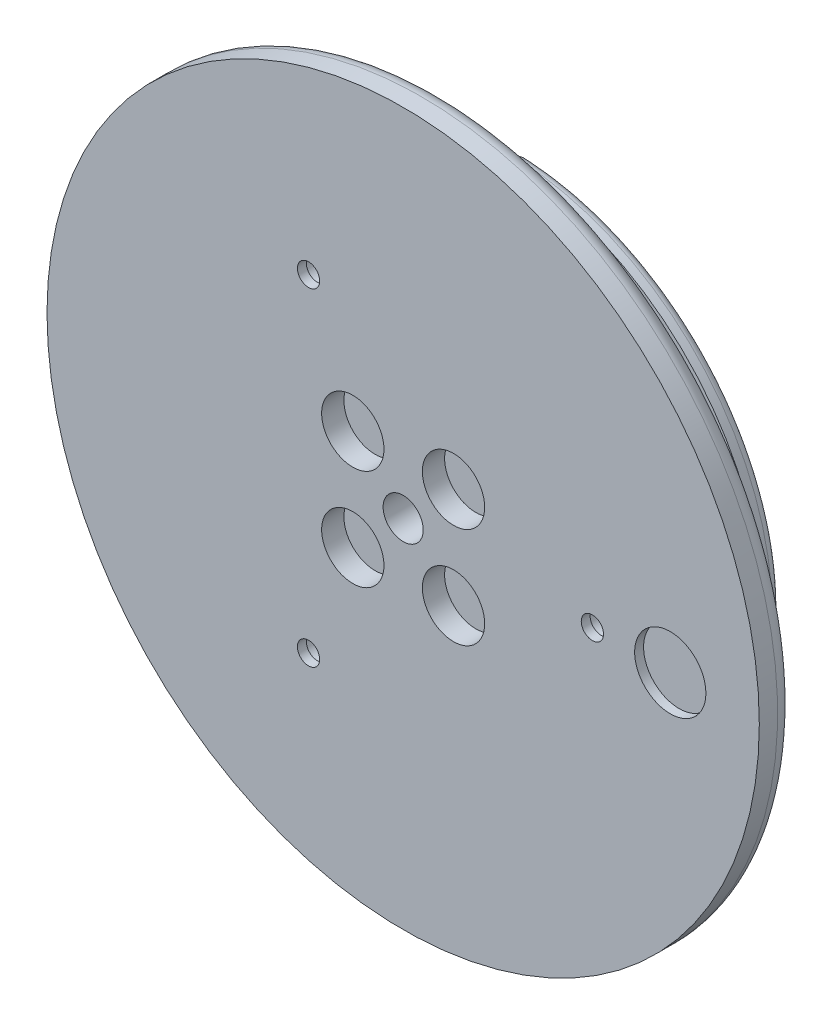
from build123d import *
from build123d.topology import SkipClean

# Parameters (mm, degrees)
SKETCH1_R             = 30
SKETCH1_R_2           = 12.5
BOSS_EXTRUDE1_DEPTH   = 6
SKETCH2_R             = 40
SKETCH2_R_2           = 2.25
SKETCH2_R_3           = 1.5
BOSS_EXTRUDE2_DEPTH   = 4
SKETCH3_R             = 3.5
CUT_EXTRUDE1_DEPTH    = 2.5
SKETCH4_R             = 5.15
CUT_EXTRUDE2_DEPTH    = 3
SKETCH5_R             = 3.5
BOSS_EXTRUDE3_DEPTH   = 0.2
SKETCH6_R             = 1.25
CUT_EXTRUDE3_DEPTH    = 10
SKETCH7_R             = 3.125
CUT_EXTRUDE4_DEPTH    = 9
SKETCH8_R             = 2
CUT_EXTRUDE5_DEPTH    = 8
SKETCH9_R             = 3
BOSS_EXTRUDE4_DEPTH   = 0.5
BOSS_EXTRUDE4_2_DEPTH = 0.5
BOSS_EXTRUDE4_3_DEPTH = 0.5
SKETCH11_R            = 3
SKETCH11_R_2          = 1.5
BOSS_EXTRUDE6_DEPTH   = 3
BOSS_EXTRUDE6_2_DEPTH = 3
BOSS_EXTRUDE6_3_DEPTH = 3
SKETCH10_R            = 30
SKETCH10_R_2          = 2
SKETCH10_R_3          = 12.5
SKETCH10_R_4          = 5.15
BOSS_EXTRUDE7_DEPTH   = 1.2
FILLET1_R             = 10
FILLET2_R             = 2
BOSS_EXTRUDE8_START   = 2
SKETCH12_R            = 12.5
SKETCH12_R_2          = 2.25
SKETCH12_R_3          = 1.5
BOSS_EXTRUDE8_DEPTH   = 2
SKETCH14_R            = 4
CUT_EXTRUDE6_DEPTH    = 1
BOSS_EXTRUDE10_START  = 0.75
SKETCH15_R            = 30
SKETCH15_R_2          = 28
BOSS_EXTRUDE10_DEPTH  = 0.75
FILLET3_R             = 10
FILLET4_R             = 4
FILLET5_R             = 1


with BuildPart() as part:
    # Sketch1 → Boss-Extrude1 (new body)
    with BuildSketch(Plane.XY):
        Circle(SKETCH1_R)
        Circle(SKETCH1_R_2, mode=Mode.SUBTRACT)
    extrude(amount=BOSS_EXTRUDE1_DEPTH)

    # Sketch2 → Boss-Extrude2 (add)
    with BuildSketch(Plane.XY.offset(6)):
        Circle(SKETCH2_R)
        Circle(SKETCH2_R_2, mode=Mode.SUBTRACT)
        with Locations((-5.655999742, 5.657708628)):
            Circle(SKETCH2_R_3, mode=Mode.SUBTRACT)
        with Locations((-5.655999742, -5.657708628)):
            Circle(SKETCH2_R_3, mode=Mode.SUBTRACT)
        with Locations((5.655999742, -5.657708628)):
            Circle(SKETCH2_R_3, mode=Mode.SUBTRACT)
        with Locations((5.655999742, 5.657708628)):
            Circle(SKETCH2_R_3, mode=Mode.SUBTRACT)
    extrude(amount=BOSS_EXTRUDE2_DEPTH)

    # Sketch3 → Cut-Extrude1 (cut)
    with BuildSketch(Plane.XY.offset(10)):
        with Locations((-5.655999742, 5.657708628)):
            Circle(SKETCH3_R)
        with Locations((5.655999742, 5.657708628)):
            Circle(SKETCH3_R)
        with Locations((5.655999742, -5.657708628)):
            Circle(SKETCH3_R)
        with Locations((-5.655999742, -5.657708628)):
            Circle(SKETCH3_R)
    extrude(amount=-CUT_EXTRUDE1_DEPTH, mode=Mode.SUBTRACT)

    # Sketch4 → Cut-Extrude2 (cut)
    with BuildSketch(Plane(origin=(0, 0, 0), x_dir=(-1, 0, 0), z_dir=(0, 0, -1))):
        with Locations((20, 0)):
            Circle(SKETCH4_R)
    extrude(amount=-CUT_EXTRUDE2_DEPTH, mode=Mode.SUBTRACT)

    # Sketch5 → Boss-Extrude3 (add)
    with BuildSketch(Plane.XY.offset(7.5)):
        with Locations((-5.655999742, 5.657708628)):
            Circle(SKETCH5_R)
        with Locations((5.655999742, 5.657708628)):
            Circle(SKETCH5_R)
        with Locations((-5.655999742, -5.657708628)):
            Circle(SKETCH5_R)
        with Locations((5.655999742, -5.657708628)):
            Circle(SKETCH5_R)
    extrude(amount=-BOSS_EXTRUDE3_DEPTH)

    # Sketch6 → Cut-Extrude3 (cut)
    with BuildSketch(Plane(origin=(0, 0, 0), x_dir=(-1, 0, 0), z_dir=(0, 0, -1))):
        with Locations((-21.25, 0)):
            Circle(SKETCH6_R)
        with Locations((10.625, 18.40303983)):
            Circle(SKETCH6_R)
        with Locations((10.625, -18.40303983)):
            Circle(SKETCH6_R)
    extrude(amount=-CUT_EXTRUDE3_DEPTH, mode=Mode.SUBTRACT)

    # Sketch7 → Cut-Extrude4 (cut)
    with BuildSketch(Plane(origin=(0, 0, 0), x_dir=(-1, 0, 0), z_dir=(0, 0, -1))):
        with Locations((-21.25, 0)):
            Circle(SKETCH7_R)
        with Locations((10.625, 18.40303983)):
            Circle(SKETCH7_R)
        with Locations((10.625, -18.40303983)):
            Circle(SKETCH7_R)
    extrude(amount=-CUT_EXTRUDE4_DEPTH, mode=Mode.SUBTRACT)

    # Sketch8 → Cut-Extrude5 (cut)
    with BuildSketch(Plane(origin=(0, 0, 0), x_dir=(-1, 0, 0), z_dir=(0, 0, -1))):
        with Locations((-10, -17.320508076)):
            Circle(SKETCH8_R)
        with Locations((-10, 17.320508076)):
            Circle(SKETCH8_R)
        with Locations((17.320508076, -10)):
            Circle(SKETCH8_R)
        with Locations((0, -20)):
            Circle(SKETCH8_R)
        with Locations((-17.320508076, -10)):
            Circle(SKETCH8_R)
        with Locations((-17.320508076, 10)):
            Circle(SKETCH8_R)
        with Locations((0, 20)):
            Circle(SKETCH8_R)
        with Locations((17.320508076, 10)):
            Circle(SKETCH8_R)
    extrude(amount=-CUT_EXTRUDE5_DEPTH, mode=Mode.SUBTRACT)

    # Fillet1
    # the kernel refuses this fillet: 10 mm, written as the material it adds along each edge
    with BuildSketch(Plane(origin=(0, 0, 6), x_dir=(1, 0, 0), z_dir=(0, -1, 0))) as fillet1_piece_1:
        with BuildLine():
            CenterArc((39.16515139, -10), FILLET1_R, 90, 66.421821522)
            Line((30, -6), (29.816696972, -5.92))
            ThreePointArc((29.816696972, -5.92), (29.8, -3), (29.8, 0))
            Line((29.8, 0), (30, 0.2))
            Line((30, 0.2), (39.16515139, 0.2))
            Line((39.16515139, 0.2), (39.16515139, 0))
        make_face()
    revolve(axis=Axis((0, 0, 6), (0, 0, 1)))

    # Fillet2
    fillet2_edges = [part.edges().sort_by_distance(p)[0] for p in [
        (-40, 0, 6),
    ]]
    fillet(fillet2_edges, radius=FILLET2_R)

    # Sketch12 → Boss-Extrude8 (add)
    with BuildSketch(Plane(origin=(0, 0, 6), x_dir=(-1, 0, 0), z_dir=(0, 0, -1)).offset(BOSS_EXTRUDE8_START)):
        Circle(SKETCH12_R)
        Circle(SKETCH12_R_2, mode=Mode.SUBTRACT)
        with Locations((-5.655999742, 5.657708628)):
            Circle(SKETCH12_R_3, mode=Mode.SUBTRACT)
        with Locations((5.655999742, 5.657708628)):
            Circle(SKETCH12_R_3, mode=Mode.SUBTRACT)
        with Locations((5.655999742, -5.657708628)):
            Circle(SKETCH12_R_3, mode=Mode.SUBTRACT)
        with Locations((-5.655999742, -5.657708628)):
            Circle(SKETCH12_R_3, mode=Mode.SUBTRACT)
    extrude(amount=-BOSS_EXTRUDE8_DEPTH)

    # Sketch14 → Cut-Extrude6 (cut)
    with BuildSketch(Plane.XY.offset(10)):
        with Locations((30, 0)):
            Circle(SKETCH14_R)
    extrude(amount=-CUT_EXTRUDE6_DEPTH, mode=Mode.SUBTRACT)


with BuildPart() as body_2:
    # Sketch9 → Boss-Extrude4 (new body)
    with BuildSketch(Plane(origin=(0, 0, 0), x_dir=(-1, 0, 0), z_dir=(0, 0, -1))):
        with Locations((-21.25, 0)):
            Circle(SKETCH9_R)
    extrude(amount=BOSS_EXTRUDE4_DEPTH)


with BuildPart() as body_3:
    # Sketch9 → Boss-Extrude4 2 (new body)
    with BuildSketch(Plane(origin=(0, 0, 0), x_dir=(-1, 0, 0), z_dir=(0, 0, -1))):
        with Locations((10.625, 18.40303983)):
            Circle(SKETCH9_R)
    extrude(amount=BOSS_EXTRUDE4_2_DEPTH)


with BuildPart() as body_4:
    # Sketch9 → Boss-Extrude4 3 (new body)
    with BuildSketch(Plane(origin=(0, 0, 0), x_dir=(-1, 0, 0), z_dir=(0, 0, -1))):
        with Locations((10.625, -18.40303983)):
            Circle(SKETCH9_R)
    extrude(amount=BOSS_EXTRUDE4_3_DEPTH)


with BuildPart() as body_5:
    # Sketch11 → Boss-Extrude6 (new body)
    with BuildSketch(Plane(origin=(0, 0, 9), x_dir=(-1, 0, 0), z_dir=(0, 0, -1))):
        with Locations((-21.25, 0)):
            Circle(SKETCH11_R)
        with Locations((-21.25, 0)):
            Circle(SKETCH11_R_2, mode=Mode.SUBTRACT)
    extrude(amount=BOSS_EXTRUDE6_DEPTH)


with BuildPart() as body_6:
    # Sketch11 → Boss-Extrude6 2 (new body)
    with BuildSketch(Plane(origin=(0, 0, 9), x_dir=(-1, 0, 0), z_dir=(0, 0, -1))):
        with Locations((10.625, 18.40303983)):
            Circle(SKETCH11_R)
        with Locations((10.625, 18.40303983)):
            Circle(SKETCH11_R_2, mode=Mode.SUBTRACT)
    extrude(amount=BOSS_EXTRUDE6_2_DEPTH)


with BuildPart() as body_7:
    # Sketch11 → Boss-Extrude6 3 (new body)
    with BuildSketch(Plane(origin=(0, 0, 9), x_dir=(-1, 0, 0), z_dir=(0, 0, -1))):
        with Locations((10.625, -18.40303983)):
            Circle(SKETCH11_R)
        with Locations((10.625, -18.40303983)):
            Circle(SKETCH11_R_2, mode=Mode.SUBTRACT)
    extrude(amount=BOSS_EXTRUDE6_3_DEPTH)


with BuildPart() as body_8:
    # Sketch10 → Boss-Extrude7 (new body)
    with BuildSketch(Plane(origin=(0, 0, -0.5), x_dir=(-1, 0, 0), z_dir=(0, 0, -1))):
        Circle(SKETCH10_R)
        with Locations((-10, 17.320508076)):
            Circle(SKETCH10_R_2, mode=Mode.SUBTRACT)
        with Locations((-10, -17.320508076)):
            Circle(SKETCH10_R_2, mode=Mode.SUBTRACT)
        with Locations((-17.320508076, 10)):
            Circle(SKETCH10_R_2, mode=Mode.SUBTRACT)
        with Locations((0, 20)):
            Circle(SKETCH10_R_2, mode=Mode.SUBTRACT)
        with Locations((17.320508076, 10)):
            Circle(SKETCH10_R_2, mode=Mode.SUBTRACT)
        with Locations((17.320508076, -10)):
            Circle(SKETCH10_R_2, mode=Mode.SUBTRACT)
        with Locations((0, -20)):
            Circle(SKETCH10_R_2, mode=Mode.SUBTRACT)
        with Locations((-17.320508076, -10)):
            Circle(SKETCH10_R_2, mode=Mode.SUBTRACT)
        Circle(SKETCH10_R_3, mode=Mode.SUBTRACT)
        with Locations((20, 0)):
            Circle(SKETCH10_R_4, mode=Mode.SUBTRACT)
    extrude(amount=BOSS_EXTRUDE7_DEPTH)

    # Sketch15 → Boss-Extrude10 (add)
    # profile 1 of 5: a face of its own
    with SkipClean():  # the faces are left unmerged after this step: merging them gives an invalid solid
        with BuildSketch(Plane(origin=(0, 0, -1.7), x_dir=(-1, 0, 0), z_dir=(0, 0, -1)).offset(BOSS_EXTRUDE10_START)):
            Circle(SKETCH15_R)
            Circle(SKETCH15_R_2, mode=Mode.SUBTRACT)
        # profile 2 of 5: a face of its own
        with BuildSketch(Plane(origin=(0, 0, -1.7), x_dir=(-1, 0, 0), z_dir=(0, 0, -1)).offset(BOSS_EXTRUDE10_START)):
            with BuildLine():
                Line((13.125043176, 24.733241632), (5.363942493, 11.290620927))
                ThreePointArc((5.363942493, 11.290620927), (6.25, 10.825317547), (7.095993301, 10.290620927))
                Line((7.095993301, 10.290620927), (14.857093983, 23.733241632))
                ThreePointArc((14.857093983, 23.733241632), (14, 24.248711306), (13.125043176, 24.733241632))
            make_face()
        # profile 3 of 5: a face of its own
        with BuildSketch(Plane(origin=(0, 0, -1.7), x_dir=(-1, 0, 0), z_dir=(0, 0, -1)).offset(BOSS_EXTRUDE10_START)):
            with BuildLine():
                ThreePointArc((7.095993301, -10.290620927), (6.25, -10.825317547), (5.363942493, -11.290620927))
                Line((5.363942493, -11.290620927), (13.125043176, -24.733241632))
                ThreePointArc((13.125043176, -24.733241632), (14, -24.248711306), (14.857093983, -23.733241632))
                Line((14.857093983, -23.733241632), (7.095993301, -10.290620927))
            make_face()
        # profile 4 of 5: a face of its own
        with BuildSketch(Plane(origin=(0, 0, -1.7), x_dir=(-1, 0, 0), z_dir=(0, 0, -1)).offset(BOSS_EXTRUDE10_START)):
            with BuildLine():
                ThreePointArc((-12.459935794, -1), (-12.489979933, -0.500401124), (-12.5, 0))
                Line((-12.5, 0), (-28, 0))
                ThreePointArc((-28, 0), (-27.995533934, -0.500079764), (-27.982137159, -1))
                Line((-27.982137159, -1), (-12.459935794, -1))
            make_face()
        # profile 5 of 5: a face of its own
        with BuildSketch(Plane(origin=(0, 0, -1.7), x_dir=(-1, 0, 0), z_dir=(0, 0, -1)).offset(BOSS_EXTRUDE10_START)):
            with BuildLine():
                Line((-28, 0), (-12.5, 0))
                ThreePointArc((-12.5, 0), (-12.489979933, 0.500401124), (-12.459935794, 1))
                Line((-12.459935794, 1), (-27.982137159, 1))
                ThreePointArc((-27.982137159, 1), (-27.995533934, 0.500079764), (-28, 0))
            make_face()
        extrude(amount=-BOSS_EXTRUDE10_DEPTH)

    # Fillet3
    # the kernel refuses this fillet: 10 mm, written as the material it adds along each edge
    with BuildSketch(Plane(origin=(-0.614353695, -3.064091814, -1.7), x_dir=(0.8660254037844383, -0.5000000000000007, 0), z_dir=(-0.5000000000000007, -0.8660254037844384, 0))) as fillet3_piece_1_section:
        with BuildLine():
            CenterArc((3.799671038, -10), FILLET3_R, 90, 22.331645009)
            Line((0, -0.75), (0, 0))
            Line((0, 0), (3.799671038, 0))
        make_face()
    fillet3_piece_1 = extrude(amount=34.520556557, mode=Mode.PRIVATE)
    fillet3_piece_1 = fillet3_piece_1 - Plane(origin=(0, 0, -1.7), x_dir=(-1, 0, 0), z_dir=(0, 0, 1)) * Cylinder(12.5, 85, mode=Mode.PRIVATE)
    fillet3_piece_1 = fillet3_piece_1 & Plane(origin=(0, 0, -1.7), x_dir=(-1, 0, 0), z_dir=(0, 0, -1)) * Cylinder(28, 85, mode=Mode.PRIVATE)
    add(fillet3_piece_1)
    with BuildSketch(Plane(origin=(0, 0, -1.7), x_dir=(-0.21807176053576605, -0.9759327370555982, 0), z_dir=(0.9759327370555982, -0.21807176053576605, 0))) as fillet3_piece_2_section:
        with BuildLine():
            CenterArc((24.200328962, 10), FILLET3_R, 270, 22.331645009)
            Line((28, 0.75), (28, 0))
            Line((28, 0), (24.200328962, 0))
        make_face()
    fillet3_piece_2 = revolve(axis=Axis((0, 0, -1.7), (0, 0, -1)), revolution_arc=154.808393171, mode=Mode.PRIVATE)
    fillet3_piece_2 = fillet3_piece_2 - Plane(origin=(-20, 0, -1.7), x_dir=(-1, 0, 0), z_dir=(0, 0, 1)) * Cylinder(5.15, 112, mode=Mode.PRIVATE)
    add(fillet3_piece_2)
    with BuildSketch(Plane(origin=(-17.874631974, 32.959770745, -1.7), x_dir=(0.8660254037844388, 0.4999999999999996, 0), z_dir=(0.49999999999999967, -0.8660254037844389, 0))) as fillet3_piece_3_section:
        with BuildLine():
            CenterArc((3.799671038, -10), FILLET3_R, 90, 22.331645009)
            Line((0, -0.75), (0, 0))
            Line((0, 0), (3.799671038, 0))
        make_face()
    fillet3_piece_3 = extrude(amount=34.520556557, mode=Mode.PRIVATE)
    fillet3_piece_3 = fillet3_piece_3 - Plane(origin=(0, 0, -1.7), x_dir=(-1, 0, 0), z_dir=(0, 0, 1)) * Cylinder(12.5, 85, mode=Mode.PRIVATE)
    fillet3_piece_3 = fillet3_piece_3 & Plane(origin=(0, 0, -1.7), x_dir=(-1, 0, 0), z_dir=(0, 0, -1)) * Cylinder(28, 85, mode=Mode.PRIVATE)
    add(fillet3_piece_3)
    with BuildSketch(Plane(origin=(37.481314755, -1, -1.7), x_dir=(0, -1, 0), z_dir=(-1, 0, 0))) as fillet3_piece_4_section:
        with BuildLine():
            CenterArc((3.799671038, -10), FILLET3_R, 90, 22.331645009)
            Line((0, -0.75), (0, 0))
            Line((0, 0), (3.799671038, 0))
        make_face()
    fillet3_piece_4 = extrude(amount=34.520556557, mode=Mode.PRIVATE)
    fillet3_piece_4 = fillet3_piece_4 - Plane(origin=(0, 0, -1.7), x_dir=(-1, 0, 0), z_dir=(0, 0, 1)) * Cylinder(12.5, 85, mode=Mode.PRIVATE)
    fillet3_piece_4 = fillet3_piece_4 & Plane(origin=(0, 0, -1.7), x_dir=(-1, 0, 0), z_dir=(0, 0, -1)) * Cylinder(28, 85, mode=Mode.PRIVATE)
    add(fillet3_piece_4)
    with BuildSketch(Plane(origin=(-19.606682781, -31.959770745, -1.7), x_dir=(-0.8660254037844383, 0.5000000000000006, 0), z_dir=(0.5000000000000007, 0.8660254037844384, 0))) as fillet3_piece_5_section:
        with BuildLine():
            CenterArc((3.799671038, -10), FILLET3_R, 90, 22.331645009)
            Line((0, -0.75), (0, 0))
            Line((0, 0), (3.799671038, 0))
        make_face()
    fillet3_piece_5 = extrude(amount=34.520556557, mode=Mode.PRIVATE)
    fillet3_piece_5 = fillet3_piece_5 - Plane(origin=(0, 0, -1.7), x_dir=(-1, 0, 0), z_dir=(0, 0, 1)) * Cylinder(12.5, 85, mode=Mode.PRIVATE)
    fillet3_piece_5 = fillet3_piece_5 & Plane(origin=(0, 0, -1.7), x_dir=(-1, 0, 0), z_dir=(0, 0, -1)) * Cylinder(28, 85, mode=Mode.PRIVATE)
    add(fillet3_piece_5)
    with BuildSketch(Plane(origin=(0, 0, -1.7), x_dir=(0.9542184229428947, 0.2991106840558777, 0), z_dir=(-0.2991106840558777, 0.9542184229428947, 0))) as fillet3_piece_6:
        with BuildLine():
            CenterArc((24.200328962, 10), FILLET3_R, 270, 22.331645009)
            Line((28, 0.75), (28, 0))
            Line((28, 0), (24.200328962, 0))
        make_face()
    revolve(axis=Axis((0, 0, -1.7), (0, 0, -1)), revolution_arc=154.808393171)
    with BuildSketch(Plane(origin=(-2.346404503, 2.064091814, -1.7), x_dir=(-0.8660254037844389, -0.49999999999999956, 0), z_dir=(-0.4999999999999995, 0.866025403784439, 0))) as fillet3_piece_7_section:
        with BuildLine():
            CenterArc((3.799671038, -10), FILLET3_R, 90, 22.331645009)
            Line((0, -0.75), (0, 0))
            Line((0, 0), (3.799671038, 0))
        make_face()
    fillet3_piece_7 = extrude(amount=34.520556557, mode=Mode.PRIVATE)
    fillet3_piece_7 = fillet3_piece_7 - Plane(origin=(0, 0, -1.7), x_dir=(-1, 0, 0), z_dir=(0, 0, 1)) * Cylinder(12.5, 85, mode=Mode.PRIVATE)
    fillet3_piece_7 = fillet3_piece_7 & Plane(origin=(0, 0, -1.7), x_dir=(-1, 0, 0), z_dir=(0, 0, -1)) * Cylinder(28, 85, mode=Mode.PRIVATE)
    add(fillet3_piece_7)
    with BuildSketch(Plane(origin=(2.960758198, 1, -1.7), x_dir=(0, 1, 0), z_dir=(1, 0, 0))) as fillet3_piece_8_section:
        with BuildLine():
            CenterArc((3.799671038, -10), FILLET3_R, 90, 22.331645009)
            Line((0, -0.75), (0, 0))
            Line((0, 0), (3.799671038, 0))
        make_face()
    fillet3_piece_8 = extrude(amount=34.520556557, mode=Mode.PRIVATE)
    fillet3_piece_8 = fillet3_piece_8 - Plane(origin=(0, 0, -1.7), x_dir=(-1, 0, 0), z_dir=(0, 0, 1)) * Cylinder(12.5, 85, mode=Mode.PRIVATE)
    fillet3_piece_8 = fillet3_piece_8 & Plane(origin=(0, 0, -1.7), x_dir=(-1, 0, 0), z_dir=(0, 0, -1)) * Cylinder(28, 85, mode=Mode.PRIVATE)
    add(fillet3_piece_8)
    with BuildSketch(Plane(origin=(0, 0, -1.7), x_dir=(-0.7361466624071481, 0.6768220529997647, 0), z_dir=(-0.6768220529997647, -0.7361466624071481, 0))) as fillet3_piece_9:
        with BuildLine():
            CenterArc((24.200328962, 10), FILLET3_R, 270, 22.331645009)
            Line((28, 0.75), (28, 0))
            Line((28, 0), (24.200328962, 0))
        make_face()
    revolve(axis=Axis((0, 0, -1.7), (0, 0, -1)), revolution_arc=154.808393171)

    # Fillet4
    fillet4_edges = [body_8.edges().sort_by_distance(p)[0] for p in [
        (-9.244492835, 18.01193128, -2.45),
        (-10.976543642, 17.01193128, -2.45),
        (-27.74891963, -3.741317863, -2.45),
        (-10.976543642, -17.01193128, -2.45),
        (-9.244492835, -18.01193128, -2.45),
        (14, -24.248711306, -2.45),
        (20.221036477, -1, -2.45),
        (20.221036477, 1, -2.45),
        (10.634383502, 25.901928259, -2.45),
    ]]
    fillet(fillet4_edges, radius=FILLET4_R)

    # Fillet5
    fillet5_edges = [body_8.edges().sort_by_distance(p)[0] for p in [
        (30, 0, -2.45),
    ]]
    fillet(fillet5_edges, radius=FILLET5_R)


solid = Compound([part.part, body_5.part, body_6.part, body_7.part, body_8.part])
